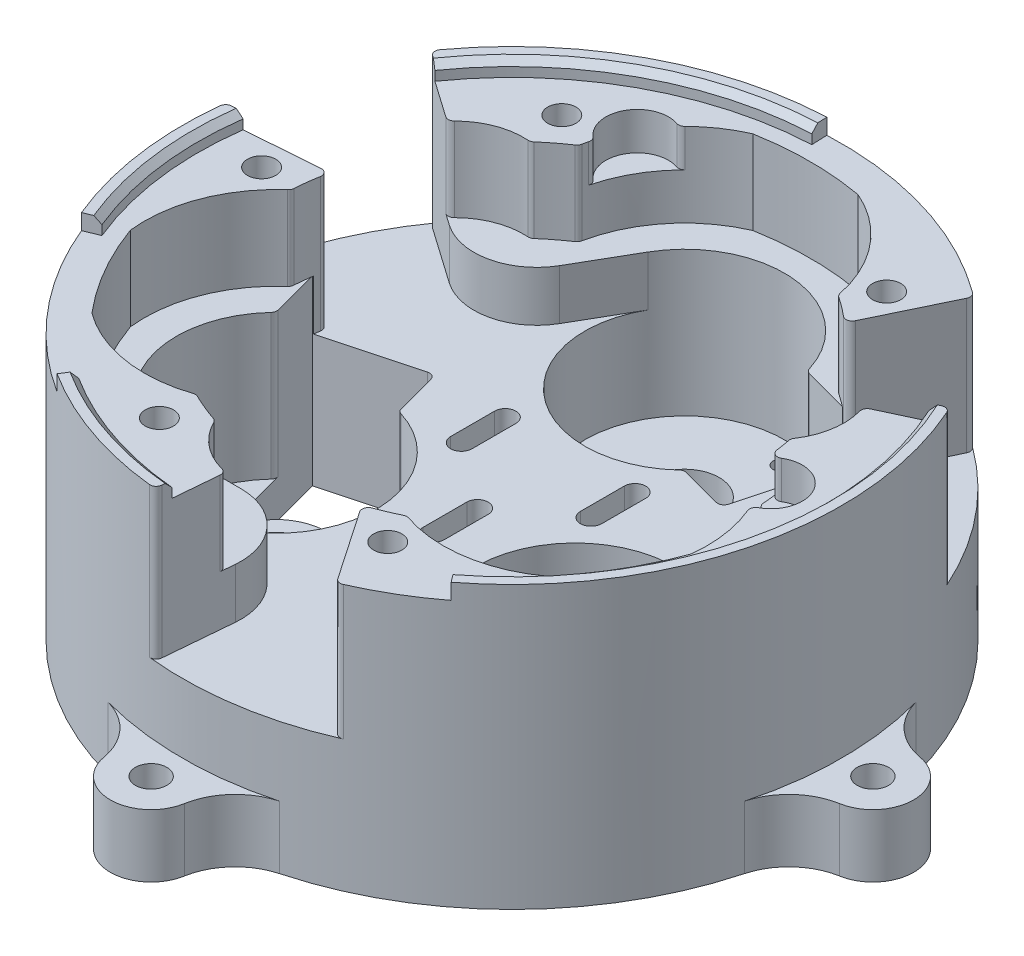
from build123d import *

# Parameters (mm, degrees)
SKETCH1_R                      = 47.5
SKETCH1_R_2                    = 5.5
BOSS_EXTRUDE1_DEPTH            = 6
D_GAGEMENT_M21_D               = 2.4
ESQUISSE1_R                    = 2.2500000000000027
ESQUISSE1_R_2                  = 2.250000000000001
ESQUISSE1_R_3                  = 2.249999999999999
ESQUISSE1_R_4                  = 2.25
ENL_V_MAT_EXTRU_1_DEPTH        = 2.5
SKETCH3_R                      = 47.50000000000001
BOSS_EXTRUDE2_DEPTH            = 15
CUT_EXTRUDE2_REACH             = 72.381
CUT_EXTRUDE3_REACH             = 76.381
CUT_EXTRUDE3_START             = -4
SKETCH11_R                     = 47.50000000000001
BOSS_EXTRUDE3_DEPTH            = 8
BOSS_EXTRUDE5_DEPTH            = 13.34
ENL_V_START                    = -13.34
ENL_V_MAT_EXTRU_2_DEPTH        = 13.34
R_P_TITION_CIRCULAIRE1_COUNT   = 3
M4_CLEARANCE_HOLE1_D           = 4.5
F_5_4_5_4_DIAMETER_HOLE1_D     = 5.4
F_5_4_5_4_DIAMETER_HOLE1_DEPTH = 7.9
F_5_4_5_4_DIAMETER_HOLE1_TIP   = 1.622323671374413
CHANFREIN1_SIZE                = 0.5
ESQUISSE10_R                   = 52.500000000000014
ESQUISSE10_R_2                 = 47.500000000000014
BOSS_EXTRU_1_DEPTH             = 29
BOSS_EXTRU_2_START             = -42.34
BOSS_EXTRU_2_DEPTH             = 13.34
BOSS_EXTRU_6_START             = 2.5
BOSS_EXTRU_6_DEPTH             = 2.5
CHANFREIN3_SIZE                = 1
ENL_V_START_2                  = -8
ENL_V_MAT_EXTRU_3_DEPTH        = 8
CONG_4_R                       = 10
CONG_2_R                       = 1
ESQUISSE17_R                   = 4.999999999999999
ESQUISSE17_R_2                 = 4.9999999999999964
ENL_V_MAT_EXTRU_4_DEPTH        = 6
CONG_5_R                       = 1
BOSS_EXTRUDE6_START            = -10
BOSS_EXTRUDE6_DEPTH            = 10
SKETCH16_R                     = 2.500000000000002
CUT_EXTRUDE4_DEPTH             = 10
FILLET1_R                      = 10


with BuildPart() as part:
    # Sketch1 → Boss-Extrude1 (new body)
    with BuildSketch(Plane(origin=(0, 0, 0), x_dir=(1, 0, 0), z_dir=(0, 1, 0))):
        with Locations(Location((0, 0, 0), (0, 0, 270))):
            Circle(SKETCH1_R)
        with Locations(Location((0, 27.5, 0), (0, 0, 270))):
            Circle(SKETCH1_R_2, mode=Mode.SUBTRACT)
        with Locations(Location((23.815698604072068, -13.749999999999996, 0), (0, 0, 270))):
            Circle(SKETCH1_R_2, mode=Mode.SUBTRACT)
        with Locations(Location((-23.815698604072058, -13.750000000000012, 0), (0, 0, 270))):
            Circle(SKETCH1_R_2, mode=Mode.SUBTRACT)
        with BuildLine():
            ThreePointArc((-33.00720682952236, -10.356450745682377), (-32.11923934280667, -11.094588318137014), (-31.12732740332647, -10.503450400515428))
            ThreePointArc((-31.12732740332647, -10.503450400515428), (-25.886250964892188, -6.022593389687454), (-19.106917120618057, -7.282591172573009))
            ThreePointArc((-19.106917120618057, -7.282591172573009), (-17.952327223900333, -7.29857565663341), (-17.552393608897226, -6.215346024042103))
            Line((-17.552393608897226, -6.215346024042103), (-21.782310986014874, 9.570920539179648))
            Line((-21.782310986014874, 9.570920539179648), (-37.237124206639976, 5.429815817539379))
            Line((-37.237124206639976, 5.429815817539379), (-33.00720682952236, -10.356450745682377))
        make_face(mode=Mode.SUBTRACT)
        with BuildLine():
            ThreePointArc((15.860367521133552, -12.90578002817256), (15.296915542037391, -11.897883604631943), (14.158844354579688, -12.09314575050758))
            Line((14.158844354579688, -12.09314575050758), (2.602495168475603, -23.649494936611575))
            Line((2.602495168475603, -23.649494936611575), (13.91620366746032, -34.96320343559638))
            Line((13.91620366746032, -34.96320343559638), (25.47255285356441, -23.406854249492383))
            ThreePointArc((25.47255285356441, -23.406854249492383), (25.667814999440036, -22.268783062034682), (24.65991857589944, -21.705331082938518))
            ThreePointArc((24.65991857589944, -21.705331082938518), (18.158844354579664, -19.406854249492355), (15.860367521133552, -12.90578002817256))
        make_face(mode=Mode.SUBTRACT)
        with BuildLine():
            ThreePointArc((3.2465495994845113, 20.18837120074555), (2.655411681862933, 19.196459261265343), (3.3935492543175547, 18.308491774549683))
            Line((3.3935492543175547, 18.308491774549683), (19.17981581753928, 14.078574397431922))
            Line((19.17981581753928, 14.078574397431922), (23.320920539179667, 29.533387618056995))
            Line((23.320920539179667, 29.533387618056995), (7.5346539759579425, 33.76330499517476))
            ThreePointArc((7.5346539759579425, 33.76330499517476), (6.451424343366632, 33.363371380171685), (6.46740882742704, 32.20878148345395))
            ThreePointArc((6.46740882742704, 32.20878148345395), (7.727406610312545, 25.4294476391798), (3.2465495994845113, 20.18837120074555))
        make_face(mode=Mode.SUBTRACT)
    extrude(amount=BOSS_EXTRUDE1_DEPTH)

    # Dégagement M21 (through all)
    with Locations(Plane(origin=(0, 6, 0), x_dir=(1, 0, 0), z_dir=(0, 1, 0))):
        with Locations((14.976863839, -4.911165235), (32.654533369, -22.588834765), (3.235238064, 39.574072829), (-3.235238064, 15.425927171), (-35.889771433, -16.985238064), (-11.741625775, -10.514761936)):
            Hole(D_GAGEMENT_M21_D / 2)

    # Esquisse1 → Enlèv. mat.-Extru.1 (cut)
    with BuildSketch(Plane.XZ):
        with Locations(Location((-35.88977143268543, 16.985238063781473, 0), (0, 0, 270))):
            Circle(ESQUISSE1_R)
        with Locations(Location((-11.741625775458694, 10.514761936218553, 0), (0, 0, 270))):
            Circle(ESQUISSE1_R_2)
        with Locations(Location((32.65453336890388, 22.588834764831876, 0), (0, 0, 270))):
            Circle(ESQUISSE1_R)
        with Locations(Location((14.976863839240247, 4.911165235168106, 0), (0, 0, 270))):
            Circle(ESQUISSE1_R_3)
        with Locations(Location((-3.235238063781559, -15.425927171386661, 0), (0, 0, 270))):
            Circle(ESQUISSE1_R_4)
        with Locations(Location((3.235238063781548, -39.57407282861333, 0), (0, 0, 270))):
            Circle(ESQUISSE1_R_2)
    extrude(amount=-ENL_V_MAT_EXTRU_1_DEPTH, mode=Mode.SUBTRACT)

    # Sketch3 → Boss-Extrude2 (add)
    with BuildSketch(Plane(origin=(0, 6, 0), x_dir=(1, 0, 0), z_dir=(0, 1, 0))):
        with Locations(Location((0, 0, 0), (0, 0, 270))):
            Circle(SKETCH3_R)
        with BuildLine():
            Line((-37.237124206639976, 5.429815817539377), (-21.78231098601487, 9.57092053917965))
            Line((-21.78231098601487, 9.57092053917965), (-19.644676640522228, 1.5931605537967464))
            ThreePointArc((-19.644676640522228, 1.5931605537967481), (-11.183809410043272, -4.0936354982955105), (-7.915698604072057, -13.750000000000012))
            ThreePointArc((-7.915698604072057, -13.750000000000016), (-29.873656965290103, -28.450719046827224), (-35.09948986114733, -2.547944167843509))
            Line((-35.09948986114734, -2.5479441678435135), (-37.237124206639976, 5.429815817539377))
        make_face(mode=Mode.SUBTRACT)
        with BuildLine():
            Line((19.756329307350516, -29.123077795706173), (13.916203667460318, -34.96320343559638))
            Line((13.916203667460318, -34.96320343559638), (2.6024951684756044, -23.649494936611575))
            Line((2.602495168475605, -23.649494936611575), (8.442620808365845, -17.80936929672138))
            ThreePointArc((8.442620808365845, -17.809369296721375), (21.768986234408096, 2.0177191906713166), (39.71569860407207, -13.749999999999996))
            ThreePointArc((39.71569860407207, -13.75), (33.51791557191315, -26.346705359296784), (19.75632930735051, -29.123077795706173))
        make_face(mode=Mode.SUBTRACT)
        with BuildLine():
            Line((23.320920539179667, 29.533387618056988), (19.17981581753928, 14.078574397431925))
            Line((19.17981581753928, 14.078574397431925), (11.202055832156402, 16.21620874292462))
            ThreePointArc((11.2020558321564, 16.21620874292462), (-15.358220637996167, 31.615222817130153), (15.343160553796801, 31.671021963549684))
            Line((15.343160553796803, 31.671021963549684), (23.320920539179667, 29.533387618056988))
        make_face(mode=Mode.SUBTRACT)
    extrude(amount=BOSS_EXTRUDE2_DEPTH)

    # Sketch6 → Cut-Extrude2 (cut, up to next)
    with BuildSketch(Plane(origin=(0, 20.999999999999996, 0), x_dir=(1, 0, 0), z_dir=(0, 1, 0)), mode=Mode.PRIVATE) as cut_extrude2_sk1:
        with BuildLine():
            Line((-12.036618828644977, 2.2622215765824008), (-12.036618828644977, 9.262221576582402))
            ThreePointArc((-12.036618828644977, 9.262221576582402), (-10.336618828644978, 10.962221576582403), (-8.636618828644977, 9.262221576582402))
            Line((-8.636618828644977, 9.262221576582402), (-8.636618828644977, 2.2622215765824008))
            ThreePointArc((-8.636618828644977, 2.2622215765824008), (-10.336618828644978, 0.5622215765824015), (-12.036618828644977, 2.2622215765824008))
        make_face()
    cut_extrude2_tool1 = extrude(cut_extrude2_sk1.sketch, amount=-CUT_EXTRUDE2_REACH, mode=Mode.PRIVATE) & part.part
    # Sketch6 → Cut-Extrude2 (cut, up to next)
    with BuildSketch(Plane(origin=(0, 20.999999999999996, 0), x_dir=(1, 0, 0), z_dir=(0, 1, 0)), mode=Mode.PRIVATE) as cut_extrude2_sk2:
        with BuildLine():
            Line((8.636618828644973, 2.2622215765824008), (8.636618828644973, 9.262221576582402))
            ThreePointArc((8.636618828644973, 9.262221576582402), (10.336618828644974, 10.962221576582401), (12.036618828644974, 9.262221576582402))
            Line((12.036618828644974, 9.262221576582402), (12.036618828644974, 2.2622215765824008))
            ThreePointArc((12.036618828644974, 2.2622215765824008), (10.336618828644974, 0.5622215765823997), (8.636618828644973, 2.2622215765824008))
        make_face()
    cut_extrude2_tool2 = extrude(cut_extrude2_sk2.sketch, amount=-CUT_EXTRUDE2_REACH, mode=Mode.PRIVATE) & part.part
    # Sketch6 → Cut-Extrude2 (cut, up to next)
    with BuildSketch(Plane(origin=(0, 20.999999999999996, 0), x_dir=(1, 0, 0), z_dir=(0, 1, 0)), mode=Mode.PRIVATE) as cut_extrude2_sk3:
        with BuildLine():
            Line((-1.6999999999999982, -12.499999999999998), (-1.6999999999999984, -5.5))
            ThreePointArc((-1.6999999999999984, -5.5), (1.74e-15, -3.8), (1.7000000000000015, -5.5))
            Line((1.7000000000000015, -5.5), (1.7000000000000013, -12.499999999999998))
            ThreePointArc((1.7000000000000013, -12.499999999999998), (1.32e-15, -14.199999999999998), (-1.6999999999999982, -12.499999999999998))
        make_face()
    cut_extrude2_tool3 = extrude(cut_extrude2_sk3.sketch, amount=-CUT_EXTRUDE2_REACH, mode=Mode.PRIVATE) & part.part
    add(cut_extrude2_tool1.solids().sort_by_distance((-10.336619, 21, -5.762222))[0], mode=Mode.SUBTRACT)
    add(cut_extrude2_tool2.solids().sort_by_distance((10.336619, 21, -5.762222))[0], mode=Mode.SUBTRACT)
    add(cut_extrude2_tool3.solids().sort_by_distance((0, 21, 9))[0], mode=Mode.SUBTRACT)

    # Sketch6<3> → Cut-Extrude3 (cut, up to next)
    with BuildSketch(Plane(origin=(0, 20.999999999999996, 0), x_dir=(1, 0, 0), z_dir=(0, 1, 0)).offset(CUT_EXTRUDE3_START), mode=Mode.PRIVATE) as cut_extrude3_sk1:
        with BuildLine():
            Line((-14.086618828644978, 2.2622215765824008), (-14.086618828644978, 9.262221576582402))
            ThreePointArc((-14.086618828644978, 9.262221576582402), (-10.336618828644978, 13.012221576582402), (-6.586618828644978, 9.262221576582402))
            Line((-6.586618828644978, 9.262221576582402), (-6.586618828644978, 2.2622215765824008))
            ThreePointArc((-6.586618828644978, 2.2622215765824008), (-10.336618828644978, -1.4877784234175992), (-14.086618828644978, 2.2622215765824008))
        make_face()
        with BuildLine():
            Line((-12.036618828644977, 2.2622215765824008), (-12.036618828644977, 9.262221576582402))
            ThreePointArc((-12.036618828644977, 9.262221576582402), (-10.336618828644978, 10.962221576582403), (-8.636618828644977, 9.262221576582402))
            Line((-8.636618828644977, 9.262221576582402), (-8.636618828644977, 2.2622215765824008))
            ThreePointArc((-8.636618828644977, 2.2622215765824008), (-10.336618828644978, 0.5622215765824015), (-12.036618828644977, 2.2622215765824008))
        make_face(mode=Mode.SUBTRACT)
    cut_extrude3_tool1 = extrude(cut_extrude3_sk1.sketch, amount=-CUT_EXTRUDE3_REACH, mode=Mode.PRIVATE) & part.part
    # Sketch6<3> → Cut-Extrude3 (cut, up to next)
    with BuildSketch(Plane(origin=(0, 20.999999999999996, 0), x_dir=(1, 0, 0), z_dir=(0, 1, 0)).offset(CUT_EXTRUDE3_START), mode=Mode.PRIVATE) as cut_extrude3_sk2:
        with BuildLine():
            Line((6.5866188286449745, 2.2622215765824008), (6.5866188286449745, 9.262221576582402))
            ThreePointArc((6.5866188286449745, 9.262221576582402), (10.336618828644974, 13.012221576582402), (14.086618828644974, 9.262221576582402))
            Line((14.086618828644974, 9.262221576582402), (14.086618828644974, 2.2622215765824008))
            ThreePointArc((14.086618828644974, 2.2622215765824008), (10.336618828644974, -1.4877784234175992), (6.5866188286449745, 2.2622215765824008))
        make_face()
        with BuildLine():
            Line((8.636618828644973, 2.2622215765824008), (8.636618828644973, 9.262221576582402))
            ThreePointArc((8.636618828644973, 9.262221576582402), (10.336618828644974, 10.962221576582401), (12.036618828644974, 9.262221576582402))
            Line((12.036618828644974, 9.262221576582402), (12.036618828644974, 2.2622215765824008))
            ThreePointArc((12.036618828644974, 2.2622215765824008), (10.336618828644974, 0.5622215765823997), (8.636618828644973, 2.2622215765824008))
        make_face(mode=Mode.SUBTRACT)
    cut_extrude3_tool2 = extrude(cut_extrude3_sk2.sketch, amount=-CUT_EXTRUDE3_REACH, mode=Mode.PRIVATE) & part.part
    # Sketch6<3> → Cut-Extrude3 (cut, up to next)
    with BuildSketch(Plane(origin=(0, 20.999999999999996, 0), x_dir=(1, 0, 0), z_dir=(0, 1, 0)).offset(CUT_EXTRUDE3_START), mode=Mode.PRIVATE) as cut_extrude3_sk3:
        with BuildLine():
            Line((-3.7499999999999982, -12.499999999999998), (-3.7499999999999982, -5.5))
            ThreePointArc((-3.7499999999999982, -5.5), (1.86e-15, -1.75), (3.7500000000000018, -5.5))
            Line((3.7500000000000018, -5.5), (3.7500000000000018, -12.499999999999998))
            ThreePointArc((3.7500000000000018, -12.499999999999998), (9.5e-16, -16.25), (-3.7499999999999982, -12.499999999999998))
        make_face()
        with BuildLine():
            Line((-1.6999999999999982, -12.499999999999998), (-1.6999999999999984, -5.5))
            ThreePointArc((-1.6999999999999984, -5.5), (1.74e-15, -3.8), (1.7000000000000015, -5.5))
            Line((1.7000000000000015, -5.5), (1.7000000000000013, -12.499999999999998))
            ThreePointArc((1.7000000000000013, -12.499999999999998), (1.32e-15, -14.199999999999998), (-1.6999999999999982, -12.499999999999998))
        make_face(mode=Mode.SUBTRACT)
    cut_extrude3_tool3 = extrude(cut_extrude3_sk3.sketch, amount=-CUT_EXTRUDE3_REACH, mode=Mode.PRIVATE) & part.part
    add(cut_extrude3_tool1.solids().sort_by_distance((-13.923371, 17, -5.762222))[0], mode=Mode.SUBTRACT)
    add(cut_extrude3_tool2.solids().sort_by_distance((6.749867, 17, -5.762222))[0], mode=Mode.SUBTRACT)
    add(cut_extrude3_tool3.solids().sort_by_distance((3.586752, 17, 9))[0], mode=Mode.SUBTRACT)

    # Sketch11 → Boss-Extrude3 (add)
    with BuildSketch(Plane(origin=(0, 20.999999999999996, 0), x_dir=(1, 0, 0), z_dir=(0, 1, 0))):
        with Locations(Location((0, 0, 0), (0, 0, 270))):
            Circle(SKETCH11_R)
        with BuildLine():
            Line((21.376153106276615, 22.275416749557625), (37.58550252424464, -5.7999999999999945))
            ThreePointArc((37.58550252424464, -5.799999999999995), (36.44758779810081, -23.406364501704566), (19.756329307350544, -29.12307779570619))
            Line((19.756329307350544, -29.12307779570619), (19.22940710305673, -29.65000000000001))
            Line((19.229407103056726, -29.650000000000006), (13.916203667460316, -34.96320343559637))
            Line((13.916203667460316, -34.96320343559637), (8.603000231863998, -29.650000000000013))
            Line((8.603000231864002, -29.65000000000001), (-23.815698604072054, -29.650000000000016))
            ThreePointArc((-23.815698604072054, -29.650000000000013), (-38.49430016776484, -19.861354688966763), (-35.09948986114735, -2.547944167843516))
            Line((-35.09948986114735, -2.5479441678435144), (-35.29235677373697, -1.8281550509600701))
            Line((-35.29235677373698, -1.828155050960071), (-37.23712420663997, 5.42981581753938))
            Line((-37.23712420663997, 5.429815817539379), (-29.979153338140584, 7.374583250442375))
            Line((-29.979153338140584, 7.374583250442374), (-13.769803920172565, 35.44999999999999))
            ThreePointArc((-13.769803920172567, 35.44999999999999), (2.0467123696640472, 43.2677191906713), (15.343160553796803, 31.671021963549684))
            Line((15.343160553796801, 31.671021963549684), (16.062949670680236, 31.478155050960055))
            Line((16.062949670680236, 31.478155050960055), (23.320920539179667, 29.533387618056988))
            Line((23.320920539179667, 29.533387618056988), (21.37615310627662, 22.275416749557625))
        make_face(mode=Mode.SUBTRACT)
    extrude(amount=BOSS_EXTRUDE3_DEPTH)

    # Sketch12 → Boss-Extrude5 (add)
    with BuildSketch(Plane(origin=(0, 28.999999999999996, 0), x_dir=(1, 0, 0), z_dir=(0, 1, 0))):
        with BuildLine():
            ThreePointArc((-36.29948824152914, -30.636532986013435), (2.91e-15, -47.500000000000014), (36.29948824152912, -30.63653298601343))
            ThreePointArc((36.29948824152912, -30.63653298601343), (26.901538556952122, -34.52203870074406), (16.779930623712474, -33.5363076122491))
            ThreePointArc((16.779930623712474, -33.5363076122491), (1.062e-14, -37.50000000000001), (-16.779930623712456, -33.53630761224911))
            ThreePointArc((-16.779930623712456, -33.53630761224911), (-26.901538556952122, -34.52203870074408), (-36.29948824152914, -30.636532986013435))
        make_face()
        with BuildLine():
            ThreePointArc((-20.65332902948094, 31.300000000000015), (-32.47595264191647, 18.74999999999999), (-37.43325965319341, 2.2363076122490706))
            ThreePointArc((-37.43325965319341, 2.2363076122490706), (-43.347731783749964, -6.0363964408351185), (-44.68175997053211, -16.118012468532086))
            ThreePointArc((-44.68175997053211, -16.118012468532086), (-41.13620667976086, 23.749999999999986), (-8.38227172900298, 46.75454545454547))
            ThreePointArc((-8.38227172900298, 46.75454545454547), (-16.446193226797835, 40.55843514157915), (-20.65332902948094, 31.300000000000015))
        make_face()
        with BuildLine():
            ThreePointArc((44.68175997053213, -16.118012468532005), (41.136206679760825, 23.750000000000014), (8.38227172900298, 46.75454545454547))
            ThreePointArc((8.38227172900298, 46.75454545454547), (16.44619322679783, 40.55843514157915), (20.65332902948094, 31.300000000000015))
            ThreePointArc((20.65332902948094, 31.300000000000015), (32.47595264191645, 18.750000000000004), (37.433259653193396, 2.236307612249102))
            ThreePointArc((37.433259653193396, 2.236307612249102), (43.347731783749964, -6.036396440835054), (44.68175997053213, -16.118012468532005))
        make_face()
    extrude(amount=BOSS_EXTRUDE5_DEPTH)

    # Esquisse2 → Enlèv. mat.-Extru.2 (cut)
    with BuildSketch(Plane(origin=(0, 42.339999999999996, 0), x_dir=(1, 0, 0), z_dir=(0, 1, 0)).offset(ENL_V_START)):
        with BuildLine():
            ThreePointArc((24.998988890888498, 27.951754049312086), (32.470638356436886, 18.75920160149386), (36.70206871050538, 7.694683383307119))
            ThreePointArc((36.70206871050569, 7.694683383307077), (38.67068144708473, 12.56485031805202), (38.15637006744407, 17.792607569845213))
            Line((38.15637006744405, 17.792607569845206), (43.049619884240926, 20.07436743268312))
            ThreePointArc((43.049619884240926, 20.074367432683125), (37.26435816585861, 29.455349437523342), (29.47285646219539, 37.25051317712041))
            Line((29.472856462195427, 37.25051317712047), (24.998988890887464, 27.9517540493123))
        make_face()
    enl_v_mat_extru_2 = extrude(amount=ENL_V_MAT_EXTRU_2_DEPTH, mode=Mode.SUBTRACT)

    # Répétition circulaire1: Enlèv. mat.-Extru.2 ×3 about axis
    r_p_tition_circulaire1_axis = Axis((-1.93e-15, 0, -5.9e-16), (0, 1, 0))
    for i in range(1, R_P_TITION_CIRCULAIRE1_COUNT):
        add(enl_v_mat_extru_2.rotate(r_p_tition_circulaire1_axis, i * 360 / R_P_TITION_CIRCULAIRE1_COUNT), mode=Mode.SUBTRACT)

    # M4 Clearance Hole1 (through all)
    with Locations(Plane(origin=(0, 42.339999999999996, 0), x_dir=(1, 0, 0), z_dir=(0, 1, 0))):
        with Locations((18.849959312, -38.648143991), (-16.455387592, -39.726819898), (-42.895254161, 2.999528371), (-26.176741447, 34.114193633), (24.045294849, 35.64861562)):
            Hole(M4_CLEARANCE_HOLE1_D / 2)

    # Ø5.4 (5.4) Diameter Hole1
    with Locations(Plane(origin=(0, 0, 0), x_dir=(-1, 0, 0), z_dir=(0, -1, 0))):
        with Locations((16.455387592, -39.726819898), (-18.849959312, -38.648143991), (-24.045294849, 35.64861562), (26.176741447, 34.114193633), (42.895254161, 2.999528371)):
            Hole(F_5_4_5_4_DIAMETER_HOLE1_D / 2, depth=F_5_4_5_4_DIAMETER_HOLE1_DEPTH)
            with Locations((0, 0, -(F_5_4_5_4_DIAMETER_HOLE1_DEPTH + F_5_4_5_4_DIAMETER_HOLE1_TIP / 2))):  # 118° drill point
                Cone(0, F_5_4_5_4_DIAMETER_HOLE1_D / 2, F_5_4_5_4_DIAMETER_HOLE1_TIP, mode=Mode.SUBTRACT)

    # Chanfrein1
    chanfrein1_edges = [part.edges().sort_by_distance(p)[0] for p in [
        (-45.595254161, 0, -2.9995283710000002),
        (-28.876741447, 0, -34.114193633),
        (21.345294849000002, 0, -35.64861562),
        (16.149959312, 0, 38.648143991),
        (-19.155387592, 0, 39.726819898),
    ]]
    chamfer(chanfrein1_edges, length=CHANFREIN1_SIZE)

    # Esquisse10 → Boss.-Extru.1 (add)
    with BuildSketch(Plane.XZ):
        with Locations(Location((0, 0, 0), (0, 0, 270))):
            Circle(ESQUISSE10_R)
        Circle(ESQUISSE10_R_2, mode=Mode.SUBTRACT)
    extrude(amount=-BOSS_EXTRU_1_DEPTH)

    # Boss.-Extru.2: read off the stored shape, not the designer's step
    # Boss.-Extru.2 outline → Boss.-Extru.2 (add)
    with BuildSketch(Plane.XZ.offset(BOSS_EXTRU_2_START)):
        with BuildLine():
            Line((31.689318201, -41.85734239), (29.472856462, -37.250513177))
            ThreePointArc((29.472856462, -37.250513177), (19.514977324, -43.306069552), (8.382271729, -46.754545455))
            ThreePointArc((8.382271729, -46.754545455), (0, -47.5), (-8.382271729, -46.754545455))
            ThreePointArc((-8.382271729, -46.754545455), (-25.579091552, -40.024493443), (-38.909722104, -27.244880727))
            Line((-38.909722104, -27.244880727), (-43.005482325, -30.112762908))
            ThreePointArc((-43.005482325, -30.112762908), (-8.15461093, -51.862822142), (31.689318201, -41.85734239))
        make_face()
        with BuildLine():
            Line((43.049619884, -20.074367433), (47.581158819, -22.187458741))
            ThreePointArc((47.581158819, -22.187458741), (48.991826952, 18.869310848), (20.404862744, 48.372425786))
            Line((20.404862744, 48.372425786), (17.523462484, 44.149499007))
            ThreePointArc((17.523462484, 44.149499007), (27.746667708, 38.553500893), (36.299488242, 30.636532986))
            ThreePointArc((36.299488242, 30.636532986), (41.13620668, 23.75), (44.681759971, 16.118012469))
            ThreePointArc((44.681759971, 16.118012469), (47.451773871, -2.139896368), (43.049619884, -20.074367433))
        make_face()
        with BuildLine():
            ThreePointArc((-4.575676494, 52.30022165), (-40.837216022, 32.993511295), (-52.094180945, -6.515083395))
            Line((-52.094180945, -6.515083395), (-46.996318946, -6.89898583))
            ThreePointArc((-46.996318946, -6.89898583), (-47.261645032, 4.752568659), (-44.681759971, 16.118012469))
            ThreePointArc((-44.681759971, 16.118012469), (-41.13620668, 23.75), (-36.299488242, 30.636532986))
            ThreePointArc((-36.299488242, 30.636532986), (-21.87268232, 42.164389811), (-4.139897781, 47.319248159))
            Line((-4.139897781, 47.319248159), (-4.575676494, 52.30022165))
        make_face()
    extrude(amount=BOSS_EXTRU_2_DEPTH)

    # Esquisse13 → Boss.-Extru.6 (add)
    with BuildSketch(Plane(origin=(0, 42.339999999999996, 0), x_dir=(1, 0, 0), z_dir=(0, 1, 0)).offset(BOSS_EXTRU_6_START)):
        with BuildLine():
            Line((47.5811588194242, 22.187458741386614), (45.31538935183257, 21.130913087034866))
            ThreePointArc((45.315389351832565, 21.13091308703487), (48.56710349066309, -11.884294616308678), (30.43807145043611, -39.66766701456172))
            Line((30.438071450436105, -39.66766701456172), (31.95997502295791, -41.65105036528981))
            ThreePointArc((31.959975022957913, -41.65105036528982), (50.99545866519624, -12.478509347124117), (47.5811588194242, 22.18745874138662))
        make_face()
        with BuildLine():
            Line((-42.17837659863282, 29.53361724381059), (-40.957602214449665, 28.678821817552226))
            ThreePointArc((-40.95760221444966, 28.678821817552222), (-24.049438445969287, 43.83633778537545), (-2.180969368266464, 49.95241107909291))
            Line((-2.180969368266464, 49.95241107909291), (-2.290017836679788, 52.450031633047566))
            ThreePointArc((-2.290017836679788, 52.450031633047566), (-24.803823757925308, 46.27116085625885), (-42.41266035960762, 30.94214344903355))
            ThreePointArc((-42.41266035960763, 30.942143449033544), (-42.591247480143245, 30.188690986414365), (-42.17837659863282, 29.53361724381059))
        make_face()
        with BuildLine():
            Line((-48.503675456842615, -20.090880199167096), (-46.1939766255644, -19.134171618254378))
            ThreePointArc((-46.19397662556441, -19.134171618254385), (-49.58404583904158, -6.436023479744768), (-49.548144370006014, 6.706816643463838))
            Line((-49.548144370006014, 6.7068166434638385), (-52.09418094520137, 6.515083395369613))
            ThreePointArc((-52.09418094520136, 6.5150833953696115), (-52.028372095136874, -7.021288851057411), (-48.50367545684261, -20.0908801991671))
        make_face()
        with BuildLine():
            ThreePointArc((-4.3577871373825765, -49.809734904587316), (-16.071973265157954, -47.346506474755344), (-26.864980417341247, -42.169572290644254))
            Line((-26.864980417341247, -42.16957229064426), (-28.208229438208313, -44.27805090517648))
            ThreePointArc((-28.208229438208317, -44.278050905176485), (-16.87557192841585, -49.7138317984931), (-4.575676494251703, -52.30022164981669))
            Line((-4.575676494251706, -52.30022164981668), (-4.357787137382579, -49.809734904587316))
        make_face()
    extrude(amount=-BOSS_EXTRU_6_DEPTH)

    # Chanfrein3
    chanfrein3_edges = [part.edges().sort_by_distance(p)[0] for p in [
        (48.56710349066309, 44.839999999999996, 11.88429461630868),
        (-24.049438445969297, 44.839999999999996, -43.83633778537545),
        (-49.58404583904158, 44.839999999999996, 6.43602347974477),
        (-16.071973265157958, 44.839999999999996, 47.346506474755344),
    ]]
    chamfer(chanfrein3_edges, length=CHANFREIN3_SIZE)

    # Esquisse15 → Enlèv. mat.-Extru.3 (cut)
    with BuildSketch(Plane(origin=(0, 28.999999999999996, 0), x_dir=(1, 0, 0), z_dir=(0, 1, 0)).offset(ENL_V_START_2)):
        with BuildLine():
            Line((-4.575676494251695, -52.3002216498167), (-2.5940388735434494, -29.650000000000016))
            Line((-2.5940388735434494, -29.650000000000016), (8.603000231864, -29.65000000000001))
            Line((8.603000231864, -29.65000000000001), (13.815377456311099, -34.86237722444715))
            ThreePointArc((13.815377456311099, -34.86237722444715), (12.76711108733792, -35.25976282511801), (11.707434641595908, -35.625636473090005))
            Line((11.707434641595908, -35.625636473090005), (20.404862744436645, -48.37242578557234))
            ThreePointArc((20.404862744436645, -48.37242578557234), (8.15461093023786, -51.86282214242152), (-4.575676494251695, -52.3002216498167))
        make_face()
        with BuildLine():
            Line((31.689318200765143, 41.85734239020267), (24.998988890887695, 27.951754049312786))
            ThreePointArc((24.998988890887695, 27.951754049312786), (24.15229479429753, 28.686523947131487), (23.28401558453172, 29.39565645225984))
            Line((23.28401558453172, 29.39565645225984), (21.376153106276618, 22.275416749557625))
            Line((21.376153106276618, 22.275416749557625), (26.97467265898048, 12.578496437106768))
            Line((26.97467265898048, 12.578496437106768), (47.58115881942421, 22.18745874138661))
            ThreePointArc((47.58115881942421, 22.18745874138661), (40.837216022172505, 32.99351129477462), (31.689318200765143, 41.85734239020267))
        make_face()
        with BuildLine():
            Line((-52.094180945201366, 6.515083395369615), (-36.70642353248332, 7.673882423777153))
            ThreePointArc((-36.70642353248332, 7.673882423777153), (-36.91940588163531, 6.573238877986481), (-37.09939304084283, 5.466720772187319))
            Line((-37.09939304084283, 5.466720772187319), (-29.979153338140588, 7.37458325044237))
            Line((-29.979153338140588, 7.37458325044237), (-24.380633785436803, 17.071503562893103))
            Line((-24.380633785436803, 17.071503562893103), (-43.00548232517215, 30.112762908429836))
            ThreePointArc((-43.00548232517215, 30.112762908429836), (-48.991826952409966, 18.869310847646737), (-52.094180945201366, 6.515083395369615))
        make_face()
    extrude(amount=ENL_V_MAT_EXTRU_3_DEPTH, mode=Mode.SUBTRACT)

    # Congé4
    cong_4_edges = [part.edges().sort_by_distance(p)[0] for p in [
        (-2.5940388735434494, 24.999999999999996, 29.650000000000016),
        (26.97467265898048, 24.999999999999996, -12.578496437106768),
        (-24.380633785436803, 24.999999999999996, -17.071503562893103),
    ]]
    fillet(cong_4_edges, radius=CONG_4_R)

    # Congé2
    cong_2_edges = [part.edges().sort_by_distance(p)[0] for p in [
        (-19.644676640522228, 13.5, -1.5931605537967481),
        (-35.09948986114734, 17.5, 2.547944167843515),
        (8.442620808365845, 13.5, 17.80936929672138),
        (19.75632930735053, 17.5, 29.123077795706184),
        (11.2020558321564, 13.5, -16.21620874292462),
        (15.343160553796801, 17.5, -31.671021963549688),
        (16.779930623712474, 35.669999999999995, 33.5363076122491),
        (-16.779930623712453, 35.669999999999995, 33.53630761224912),
        (20.653329029480943, 35.669999999999995, -31.30000000000002),
        (37.4332596531934, 35.669999999999995, -2.2363076122491012),
        (-20.653329029480943, 35.669999999999995, -31.300000000000015),
        (-37.43325965319342, 35.669999999999995, -2.23630761224907),
        (36.702068710505536, 35.669999999999995, -7.694683383307098),
        (24.99898889088784, 31.669999999999995, -27.95175404931249),
        (38.15637006744406, 35.669999999999995, -17.79260756984521),
        (19.17981581753928, 10.5, -14.078574397431924),
        (2.6024951684756035, 10.5, 23.649494936611575),
        (-21.78231098601487, 10.5, -9.57092053917965),
        (-25.014825639274704, 35.669999999999995, -27.937582183086228),
        (-36.706423532483115, 31.669999999999995, -7.673882423777515),
        (-34.48703518877528, 35.669999999999995, -24.148082009684114),
        (-11.687243071230853, 35.669999999999995, 35.63226556639331),
        (11.707434641595402, 31.669999999999995, 35.62563647309003),
        (-3.6693348786687974, 35.669999999999995, 41.940689579529305),
        (-52.094180945, 35.67, -6.515083395),
        (-4.575676494, 35.67, 52.30022165),
        (20.404862744, 35.67, 48.372425785999994),
        (47.581158818999995, 35.67, -22.187458741),
        (31.689318201, 35.67, -41.85734239),
        (-43.005482325, 35.67, -30.112762908),
    ]]
    fillet(cong_2_edges, radius=CONG_2_R - 0.0001)  # a hair under: the kernel refuses the full size

    # Esquisse17 → Enlèv. mat.-Extru.4 (cut)
    with BuildSketch(Plane(origin=(0, 42.339999999999996, 0), x_dir=(1, 0, 0), z_dir=(0, 1, 0))):
        with Locations((-17.433003296803903, 37.38519621526178)):
            Circle(ESQUISSE17_R)
        with Locations((41.25, 0)):
            Circle(ESQUISSE17_R_2)
    extrude(amount=-ENL_V_MAT_EXTRU_4_DEPTH, mode=Mode.SUBTRACT)

    # Congé5
    cong_5_edges = [part.edges().sort_by_distance(p)[0] for p in [
        (-15.285008835828794, 39.339999999999996, -41.90029530560523),
        (-20.204884663034242, 39.339999999999996, -33.223865455571435),
        (37.367424242424256, 39.339999999999996, -3.1504928958315332),
        (42.79229816121487, 39.339999999999996, 4.756187168511469),
    ]]
    fillet(cong_5_edges, radius=CONG_5_R)

    # Sketch14 → Boss-Extrude6 (add)
    with BuildSketch(Plane.XZ.offset(BOSS_EXTRUDE6_START)):
        with BuildLine():
            Line((-57.49606511052444, 6.500000000000001), (-52.09606511052444, 6.500000000000001))
            ThreePointArc((-52.09606511052444, 6.500000000000001), (-52.50000000000002, 6.43e-15), (-52.09606511052444, -6.500000000000001))
            Line((-52.09606511052444, -6.500000000000001), (-57.49606511052444, -6.500000000000001))
            ThreePointArc((-57.49606511052444, -6.500000000000001), (-63.99606511052444, 8e-16), (-57.49606511052444, 6.500000000000001))
        make_face()
        with BuildLine():
            Line((-6.499999999999995, -57.49606511052444), (-6.499999999999995, -52.09606511052444))
            ThreePointArc((-6.499999999999995, -52.09606511052444), (3.21e-15, -52.50000000000002), (6.499999999999995, -52.09606511052444))
            Line((6.499999999999995, -52.09606511052444), (6.499999999999995, -57.49606511052444))
            ThreePointArc((6.499999999999995, -57.49606511052444), (4.88e-15, -63.99606511052444), (-6.499999999999995, -57.49606511052444))
        make_face()
        with BuildLine():
            Line((-6.500000000000002, 57.49606511052444), (-6.5, 52.09606511052444))
            ThreePointArc((-6.5, 52.09606511052444), (3.21e-15, 52.50000000000002), (6.5, 52.09606511052444))
            Line((6.5, 52.09606511052444), (6.500000000000002, 57.49606511052444))
            ThreePointArc((6.500000000000002, 57.49606511052444), (1.27e-15, 63.99606511052444), (-6.500000000000002, 57.49606511052444))
        make_face()
        with BuildLine():
            Line((57.49606511052444, 6.500000000000001), (52.09606511052444, 6.500000000000001))
            ThreePointArc((52.09606511052444, 6.500000000000001), (52.50000000000002, 0), (52.09606511052444, -6.500000000000001))
            Line((52.09606511052444, -6.500000000000001), (57.49606511052444, -6.500000000000001))
            ThreePointArc((57.49606511052444, -6.500000000000001), (63.99606511052444, 0), (57.49606511052444, 6.500000000000001))
        make_face()
    extrude(amount=BOSS_EXTRUDE6_DEPTH)

    # Sketch16 → Cut-Extrude4 (cut)
    with BuildSketch(Plane.XZ):
        with Locations(Location((-57.49606511052444, 0, 0), (0, 0, 270))):
            Circle(SKETCH16_R)
        with Locations(Location((8.7e-16, 57.49606511052444, 0), (0, 0, 270))):
            Circle(SKETCH16_R)
        with Locations(Location((57.49606511052444, 0, 0), (0, 0, 270))):
            Circle(SKETCH16_R)
        with Locations(Location((6.07e-15, -57.49606511052444, 0), (0, 0, 270))):
            Circle(SKETCH16_R)
    extrude(amount=-CUT_EXTRUDE4_DEPTH, mode=Mode.SUBTRACT)

    # Fillet1
    # the kernel refuses this fillet: 10 mm, written as the material it adds along each edge
    with BuildSketch(Plane(origin=(52.09606511052444, 10, 6.500000000000001), x_dir=(-0.19237882879908283, 0, 0.9813207356567439), z_dir=(0, -1, 0))) as fillet1_piece_1:
        with BuildLine():
            CenterArc((7.981208553561338, -9.975887871671526), FILLET1_R, 93.97963009747873, 64.96774011867397)
            Line((-1.3512999378600015, -6.383634364811435), (-2.284550787002135, -6.024409014125423))
            ThreePointArc((-2.284550787002135, -6.024409014125423), (-2.020166411171791, -5.1067531437473335), (-0.9813207356567439, 0.19237882879908283))
            Line((-0.9813207356567439, 0.19237882879908283), (0.06940181350923053, 0.9975887871671488))
            ThreePointArc((0.06940181350923053, 0.9975887871671488), (3.6435952092345363, 0.8734113262755034), (7.217788604959834, 0.9975887871671525))
            Line((7.217788604959834, 0.9975887871671525), (7.287190418469061, -2.2e-16))
        make_face()
    extrude(amount=10)
    with BuildSketch(Plane(origin=(52.09606511052444, 10, -6.5), x_dir=(-0.19237882879908183, 0, -0.9813207356567442), z_dir=(0, -1, 0))) as fillet1_piece_2:
        with BuildLine():
            CenterArc((7.98120855356135, 9.975887871671524), FILLET1_R, 201.05262978384727, 64.96774011867393)
            Line((-1.351299937859989, 6.383634364811438), (-2.284550787002123, 6.0244090141254265))
            ThreePointArc((-2.284550787002123, 6.0244090141254265), (-2.020166411171787, 5.106753143747334), (-0.9813207356567442, -0.19237882879908183))
            Line((-0.9813207356567442, -0.19237882879908183), (0.0694018135092295, -0.9975887871671489))
            ThreePointArc((0.0694018135092295, -0.9975887871671489), (3.6435952092345385, -0.8734113262755068), (7.217788604959834, -0.9975887871671523))
            Line((7.217788604959834, -0.9975887871671523), (7.287190418469063, 2.2e-16))
        make_face()
    extrude(amount=10)
    with BuildSketch(Plane(origin=(6.499999999999995, 10, -52.096065110524435), x_dir=(0.9813207356567442, 0, 0.19237882879908183), z_dir=(0, -1, 0))) as fillet1_piece_3:
        with BuildLine():
            CenterArc((7.981208553561348, -9.975887871671524), FILLET1_R, 93.97963009747878, 64.96774011867402)
            Line((-1.3512999378599968, -6.383634364811451), (-2.284550787002132, -6.024409014125447))
            ThreePointArc((-2.284550787002132, -6.024409014125447), (-2.020166411171788, -5.1067531437473415), (-0.9813207356567442, 0.19237882879908183))
            Line((-0.9813207356567442, 0.19237882879908183), (0.0694018135092295, 0.9975887871671489))
            ThreePointArc((0.0694018135092295, 0.9975887871671489), (3.643595209234533, 0.8734113262755006), (7.217788604959834, 0.9975887871671523))
            Line((7.217788604959834, 0.9975887871671523), (7.287190418469063, -2.2e-16))
        make_face()
    extrude(amount=10)
    with BuildSketch(Plane(origin=(-6.499999999999995, 10, -52.09606511052444), x_dir=(-0.9813207356567443, 0, 0.19237882879908139), z_dir=(0, -1, 0))) as fillet1_piece_4:
        with BuildLine():
            CenterArc((7.981208553561327, 9.975887871671523), FILLET1_R, 201.05262978384724, 64.96774011867399)
            Line((-1.3512999378600137, 6.38363436481144), (-2.2845507870021473, 6.02440901412543))
            ThreePointArc((-2.2845507870021473, 6.02440901412543), (-2.0201664111717843, 5.106753143747336), (-0.9813207356567443, -0.19237882879908139))
            Line((-0.9813207356567443, -0.19237882879908139), (0.06940181350922817, -0.9975887871671492))
            ThreePointArc((0.06940181350922817, -0.9975887871671492), (3.6435952092345394, -0.8734113262755081), (7.217788604959814, -0.997588787167152))
            Line((7.217788604959814, -0.997588787167152), (7.287190418469042, 0))
        make_face()
    extrude(amount=10)
    with BuildSketch(Plane(origin=(-52.09606511052444, 10, -6.5), x_dir=(0.1923788287990823, 0, -0.981320735656744), z_dir=(0, -1, 0))) as fillet1_piece_5:
        with BuildLine():
            CenterArc((7.981208553561322, -9.975887871671524), FILLET1_R, 93.97963009747873, 64.96774011867394)
            Line((-1.3512999378600166, -6.3836343648114315), (-2.28455078700215, -6.02440901412542))
            ThreePointArc((-2.28455078700215, -6.02440901412542), (-2.0201664111717883, -5.106753143747334), (-0.981320735656744, 0.1923788287990823))
            Line((-0.981320735656744, 0.1923788287990823), (0.06940181350922998, 0.9975887871671488))
            ThreePointArc((0.06940181350922998, 0.9975887871671488), (3.6435952092344954, 0.8734113262755062), (7.217788604959815, 0.9975887871671527))
            Line((7.217788604959815, 0.9975887871671527), (7.287190418469044, 2.2e-16))
        make_face()
    extrude(amount=10)
    with BuildSketch(Plane(origin=(-52.09606511052444, 10, 6.500000000000001), x_dir=(0.1923788287990823, 0, 0.981320735656744), z_dir=(0, -1, 0))) as fillet1_piece_6:
        with BuildLine():
            CenterArc((7.981208553561367, 9.975887871671524), FILLET1_R, 201.05262978384718, 64.96774011867404)
            Line((-1.3512999378599782, 6.383634364811455), (-2.2845507870021136, 6.0244090141254505))
            ThreePointArc((-2.2845507870021136, 6.0244090141254505), (-2.020166411171789, 5.106753143747334), (-0.981320735656744, -0.1923788287990823))
            Line((-0.981320735656744, -0.1923788287990823), (0.06940181350922911, -0.997588787167149))
            ThreePointArc((0.06940181350922911, -0.997588787167149), (3.643595209234577, -0.8734113262755047), (7.2177886049598525, -0.9975887871671525))
            Line((7.2177886049598525, -0.9975887871671525), (7.2871904184690806, 0))
        make_face()
    extrude(amount=10)
    with BuildSketch(Plane(origin=(-6.5, 10, 52.09606511052444), x_dir=(-0.9813207356567439, 0, -0.19237882879908255), z_dir=(0, -1, 0))) as fillet1_piece_7:
        with BuildLine():
            CenterArc((7.98120855356135, -9.975887871671524), FILLET1_R, 93.97963009747875, 64.96774011867402)
            Line((-1.3512999378599897, -6.383634364811444), (-2.2845507870021233, -6.024409014125433))
            ThreePointArc((-2.2845507870021233, -6.024409014125433), (-2.0201664111717887, -5.1067531437473335), (-0.9813207356567439, 0.19237882879908255))
            Line((-0.9813207356567439, 0.19237882879908255), (0.06940181350923025, 0.9975887871671488))
            ThreePointArc((0.06940181350923025, 0.9975887871671488), (3.643595209234523, 0.8734113262755069), (7.217788604959842, 0.9975887871671525))
            Line((7.217788604959842, 0.9975887871671525), (7.287190418469071, 0))
        make_face()
    extrude(amount=10)
    with BuildSketch(Plane(origin=(6.5, 10, 52.09606511052444), x_dir=(0.981320735656744, 0, -0.19237882879908233), z_dir=(0, -1, 0))) as fillet1_piece_8:
        with BuildLine():
            CenterArc((7.9812085535613635, 9.975887871671524), FILLET1_R, 201.0526297838472, 64.96774011867404)
            Line((-1.351299937859978, 6.383634364811447), (-2.284550787002112, 6.024409014125435))
            ThreePointArc((-2.284550787002112, 6.024409014125435), (-2.0201664111717874, 5.106753143747334), (-0.981320735656744, -0.19237882879908233))
            Line((-0.981320735656744, -0.19237882879908233), (0.06940181350923001, -0.9975887871671488))
            ThreePointArc((0.06940181350923001, -0.9975887871671488), (3.6435952092345505, -0.8734113262755024), (7.217788604959852, -0.9975887871671525))
            Line((7.217788604959852, -0.9975887871671525), (7.2871904184690806, 0))
        make_face()
    extrude(amount=10)


solid = part.part
